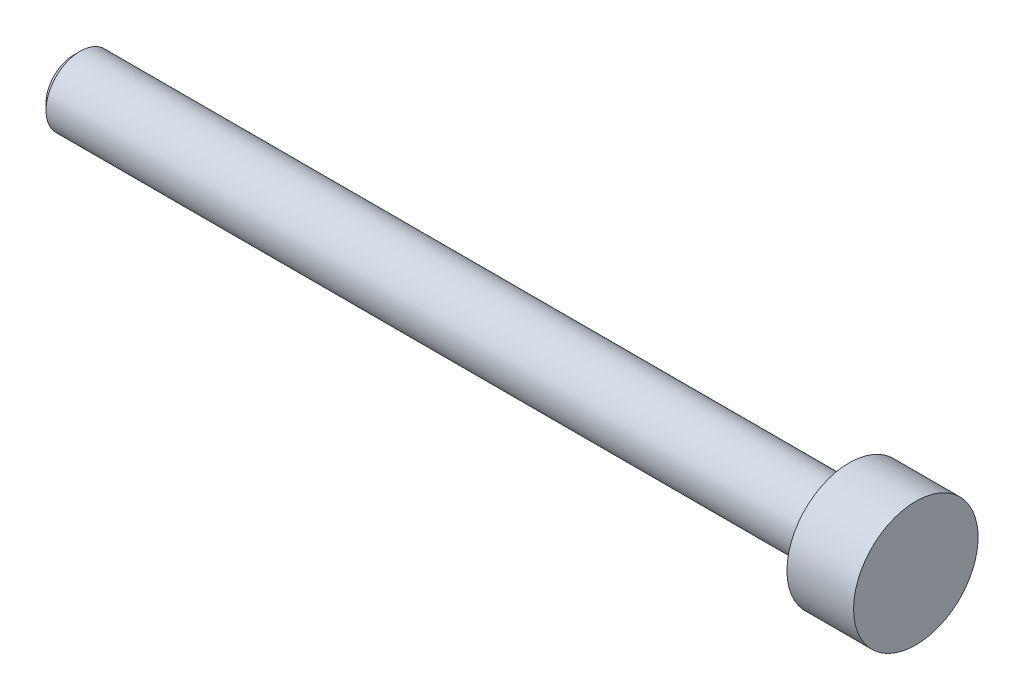
from build123d import *


# Read off the part's stored shape, not the designer's step: M3x0.5 Machine Threads Stud1
with BuildPart() as part:
    # Sketch1 → Revolve1 (revolve)
    with BuildSketch(Plane(origin=(0, 0, 0), x_dir=(-1, 0, 0), z_dir=(0, 1, 0))):
        Polygon((0, 1.524), (0, 0), (-36.921000072, 0), (-36.921000072, 2.7305), (-34.000000072, 2.7305), (-34.000000072, 1.524), align=None)
    revolve(axis=Axis((0, 0, 0), (1, 0, 0)))

    # M3x0.5 Machine Threads Stud1 outline → M3x0.5 Machine Threads Stud1 (revolve, cut)
    with BuildSketch(Plane.YX):
        Polygon((1.524, 34.000000072), (1.5, 34.000000072), (1.5, 0.2805), (1.2195, 0), (1.524, 0), align=None)
    revolve(axis=Axis((0, 0, 0), (1, 0, 0)), mode=Mode.SUBTRACT)


solid = part.part
